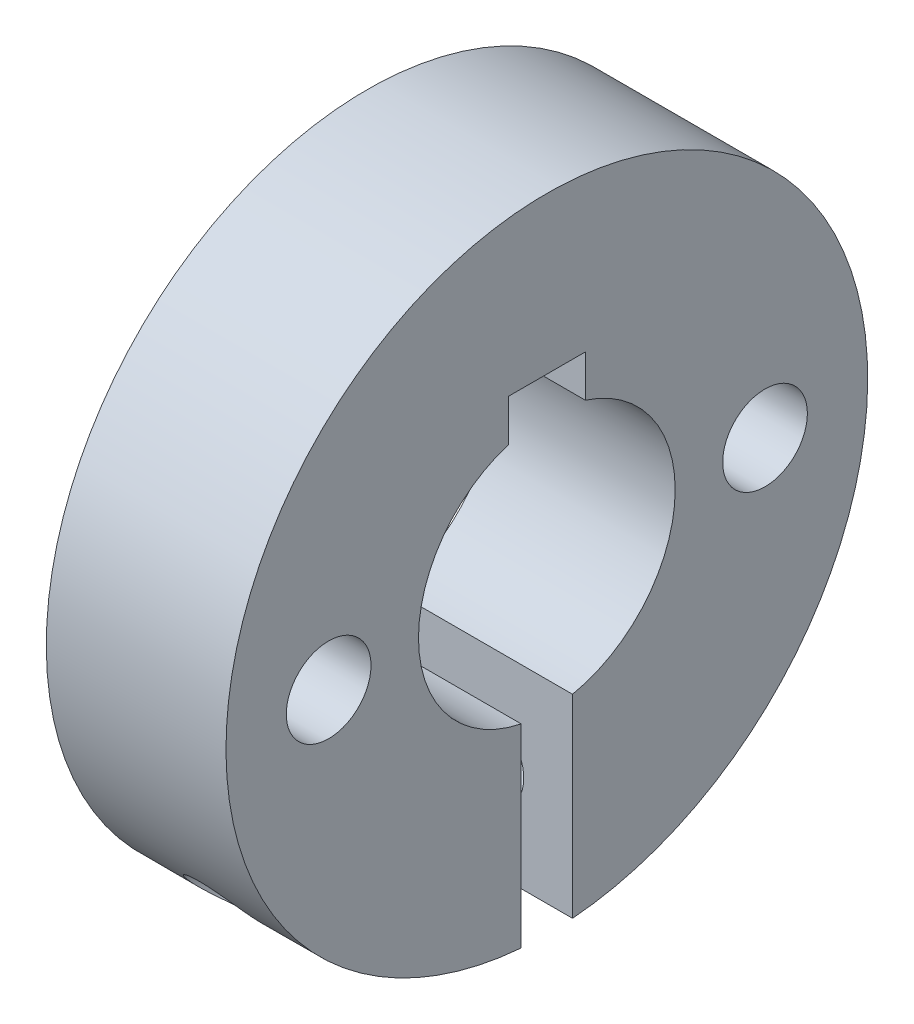
from build123d import *

# Parameters (mm, degrees)
SKETCH1_R                                           = 1
BOSS_EXTRUDE1_DEPTH                                 = 7
SKETCH3_W                                           = 1.25
SKETCH3_H                                           = 11.5
CBORE_FOR_M3_HEX_SOCKET_HEAD_CAP_SCREW1_D           = 3.2
CBORE_FOR_M3_HEX_SOCKET_HEAD_CAP_SCREW1_DEPTH       = 6
CBORE_FOR_M3_HEX_SOCKET_HEAD_CAP_SCREW1_CBORE_D     = 6.5
CBORE_FOR_M3_HEX_SOCKET_HEAD_CAP_SCREW1_CBORE_DEPTH = 3.4
CBORE_FOR_M3_HEX_SOCKET_HEAD_CAP_SCREW1_TIP         = 0.96137699
SKETCH9_R                                           = 3.25
CUT_EXTRUDE1_DEPTH                                  = 22.551334231
TAP_DRILL_FOR_M4_TAP1_OUTLINE_R                     = 1.65
TAP_DRILL_FOR_M4_TAP1_OUTLINE_R_2                   = 1
TAP_DRILL_FOR_M4_TAP1_DEPTH                         = 7


# Read off the part's stored shape, not the designer's step: Tap Drill for M4 Tap1
with BuildPart() as part:
    # Sketch1 → Boss-Extrude1 (new body)
    with BuildSketch(Plane(origin=(0, 0, 0), x_dir=(0, 0, -1), z_dir=(1, 0, 0))):
        with BuildLine():
            ThreePointArc((-1, -4.898979486), (-4.993327693, -0.258221909), (-1.5, 4.769696007))
            Line((-1.5, 4.769696007), (-1.5, 6.4))
            Line((-1.5, 6.4), (1.5, 6.4))
            Line((1.5, 6.4), (1.5, 4.769696007))
            ThreePointArc((1.5, 4.769696007), (4.031128874, 2.958039892), (5, 0))
            ThreePointArc((5, 0), (3.872983346, -3.16227766), (1, -4.898979486))
            Line((1, -4.898979486), (1, -12.459935794))
            ThreePointArc((1, -12.459935794), (9.185586535, -8.477912479), (12.5, 0))
            ThreePointArc((12.5, 0), (-8.477912479, 9.185586535), (-1, -12.459935794))
            Line((-1, -12.459935794), (-1, -4.898979486))
        make_face()
        with Locations((-8.5, 0)):
            Circle(SKETCH1_R, mode=Mode.SUBTRACT)
        with Locations((8.5, 0)):
            Circle(SKETCH1_R, mode=Mode.SUBTRACT)
    extrude(amount=BOSS_EXTRUDE1_DEPTH)

    # Sketch3 → Tap Drill for M3 Tap2 (revolve, cut)
    with BuildSketch(Plane(origin=(3.5, -8.67945764, 1), x_dir=(0, 1, 0), z_dir=(1, 0, 0))):
        with Locations((0.625, 5.75)):
            Rectangle(SKETCH3_W, SKETCH3_H)
    revolve(axis=Axis((3.5, -8.67945764, -5.35), (0, 0, 1)), mode=Mode.SUBTRACT)

    # CBORE for M3 Hex Socket Head Cap Screw1
    with Locations(Plane(origin=(0, 0, -7), x_dir=(-1, 0, 0), z_dir=(0, 0, -1))):
        with Locations((-3.5, -8.67945764)):
            CounterBoreHole(CBORE_FOR_M3_HEX_SOCKET_HEAD_CAP_SCREW1_D / 2, CBORE_FOR_M3_HEX_SOCKET_HEAD_CAP_SCREW1_CBORE_D / 2, CBORE_FOR_M3_HEX_SOCKET_HEAD_CAP_SCREW1_CBORE_DEPTH, depth=CBORE_FOR_M3_HEX_SOCKET_HEAD_CAP_SCREW1_DEPTH)
            with Locations((0, 0, -(CBORE_FOR_M3_HEX_SOCKET_HEAD_CAP_SCREW1_DEPTH + CBORE_FOR_M3_HEX_SOCKET_HEAD_CAP_SCREW1_TIP / 2))):  # 118° drill point
                Cone(0, CBORE_FOR_M3_HEX_SOCKET_HEAD_CAP_SCREW1_D / 2, CBORE_FOR_M3_HEX_SOCKET_HEAD_CAP_SCREW1_TIP, mode=Mode.SUBTRACT)

    # Sketch9 → Cut-Extrude1 (cut, through all)
    with BuildSketch(Plane(origin=(0, 0, -3.6), x_dir=(-1, 0, 0), z_dir=(0, 0, -1))):
        with Locations(Location((-3.5, -8.67945764, 0), (0, 0, 90))):
            Circle(SKETCH9_R)
    extrude(amount=CUT_EXTRUDE1_DEPTH, mode=Mode.SUBTRACT)

    # Tap Drill for M4 Tap1 outline → Tap Drill for M4 Tap1 (cut)
    # profile 1 of 2: a face of its own
    with BuildSketch(Plane.YZ):
        with Locations((0, 8.5)):
            Circle(TAP_DRILL_FOR_M4_TAP1_OUTLINE_R)
        with Locations((0, 8.5)):
            Circle(TAP_DRILL_FOR_M4_TAP1_OUTLINE_R_2, mode=Mode.SUBTRACT)
    # profile 2 of 2: a face of its own
    with BuildSketch(Plane.YZ):
        with Locations((0, -8.5)):
            Circle(TAP_DRILL_FOR_M4_TAP1_OUTLINE_R)
        with Locations((0, -8.5)):
            Circle(TAP_DRILL_FOR_M4_TAP1_OUTLINE_R_2, mode=Mode.SUBTRACT)
    extrude(amount=TAP_DRILL_FOR_M4_TAP1_DEPTH, mode=Mode.SUBTRACT)


solid = part.part
